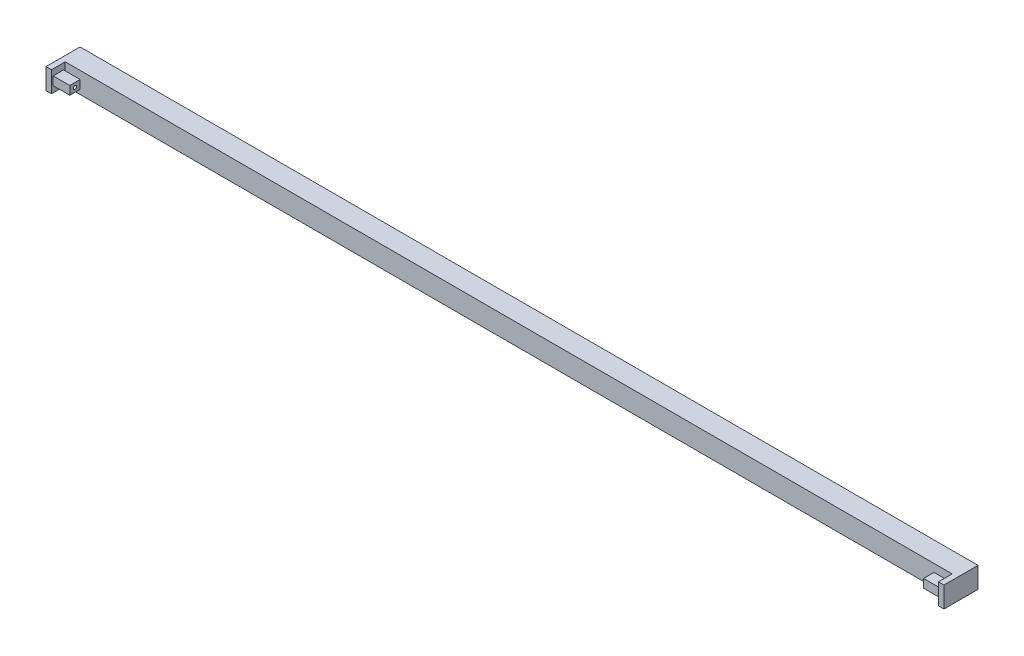
from build123d import *

# Parameters (mm, degrees)
SKETCH1_W           = 1635
SKETCH1_H           = 38
BOSS_EXTRUDE1_DEPTH = 62
SKETCH2_W           = 1615
SKETCH2_H           = 38
CUT_EXTRUDE1_DEPTH  = 25
SKETCH3_W           = 18.796
SKETCH3_H           = 15.494
BOSS_EXTRUDE2_DEPTH = 30.226
SKETCH5_W           = 18.91876422
SKETCH5_H           = 15.494
BOSS_EXTRUDE3_DEPTH = 30.226
SKETCH6_R           = 3
CUT_EXTRUDE2_DEPTH  = 10
SKETCH7_R           = 3
CUT_EXTRUDE3_DEPTH  = 10


with BuildPart() as part:
    # Sketch1 → Boss-Extrude1 (new body)
    with BuildSketch(Plane.XY):
        with Locations((817.5, 19)):
            Rectangle(SKETCH1_W, SKETCH1_H)
    extrude(amount=BOSS_EXTRUDE1_DEPTH)

    # Sketch2 → Cut-Extrude1 (cut)
    with BuildSketch(Plane.XY.offset(62)):
        with Locations((817.5, 19)):
            Rectangle(SKETCH2_W, SKETCH2_H)
    extrude(amount=-CUT_EXTRUDE1_DEPTH, mode=Mode.SUBTRACT)

    # Sketch3 → Boss-Extrude2 (add)
    with BuildSketch(Plane(origin=(10, 0, 0), x_dir=(0, 0, -1), z_dir=(1, 0, 0))):
        with Locations((-49.502, 18.998)):
            Rectangle(SKETCH3_W, SKETCH3_H)
    extrude(amount=BOSS_EXTRUDE2_DEPTH)

    # Sketch5 → Boss-Extrude3 (add)
    with BuildSketch(Plane.ZY.offset(-1625)):
        with Locations((49.44061789, 18.993)):
            Rectangle(SKETCH5_W, SKETCH5_H)
    extrude(amount=BOSS_EXTRUDE3_DEPTH)

    # Sketch6 → Cut-Extrude2 (cut)
    with BuildSketch(Plane(origin=(40.226, 0, 0), x_dir=(0, 0, -1), z_dir=(1, 0, 0))):
        with Locations((-49.504, 18.996)):
            Circle(SKETCH6_R)
    extrude(amount=-CUT_EXTRUDE2_DEPTH, mode=Mode.SUBTRACT)

    # Sketch7 → Cut-Extrude3 (cut)
    with BuildSketch(Plane.ZY.offset(-1594.774)):
        with Locations((49.38123578, 18.995)):
            Circle(SKETCH7_R)
    extrude(amount=-CUT_EXTRUDE3_DEPTH, mode=Mode.SUBTRACT)


solid = part.part
